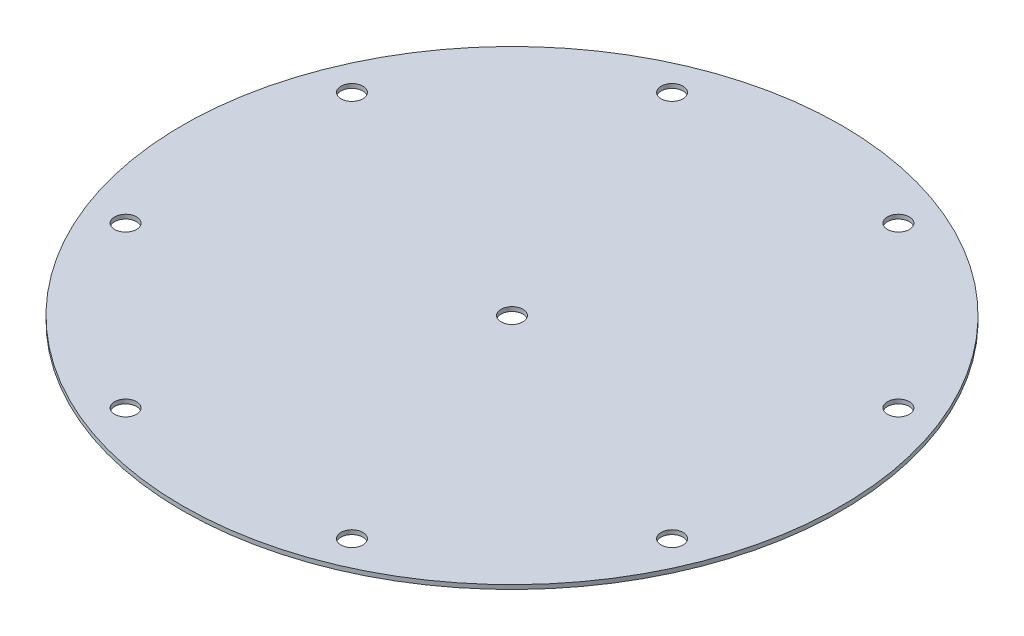
from build123d import *

# Parameters (mm, degrees)
SKETCH2_W                  = 77.99983
SKETCH2_H                  = 1
F_6_0_204_DIAMETER_HOLE1_D = 5.1816
CIRPATTERN3_COUNT          = 8
F_6_0_204_DIAMETER_HOLE2_D = 5.1816


with BuildPart() as part:
    # Sketch2 → Revolve1 (revolve)
    with BuildSketch(Plane(origin=(0, 0, 0), x_dir=(0, 0, -1), z_dir=(1, 0, 0))):
        with Locations((-38.999915, 0.5)):
            Rectangle(SKETCH2_W, SKETCH2_H)
    revolve(axis=Axis((0, -0.05, 0), (0, 1, 0)))

    # #6 (0.204) Diameter Hole1 (through all)
    with Locations(Plane(origin=(0, 1, 0), x_dir=(1, 0, 0), z_dir=(0, 1, 0))):
        with Locations((-26.787840266, 64.671567276)):
            f_6_0_204_diameter_hole1 = Hole(F_6_0_204_DIAMETER_HOLE1_D / 2)

    # CirPattern3: #6 (0.204) Diameter Hole1 ×8 about axis
    cirpattern3_axis = Axis((0, -0.05, 0), (0, 1, 0))
    for i in range(1, CIRPATTERN3_COUNT):
        add(f_6_0_204_diameter_hole1.rotate(cirpattern3_axis, i * 360 / CIRPATTERN3_COUNT), mode=Mode.SUBTRACT)

    # #6 (0.204) Diameter Hole2 (through all)
    with Locations(Plane(origin=(0, 1, 0), x_dir=(1, 0, 0), z_dir=(0, 1, 0))):
        with Locations((0, 0)):
            Hole(F_6_0_204_DIAMETER_HOLE2_D / 2)


solid = part.part
